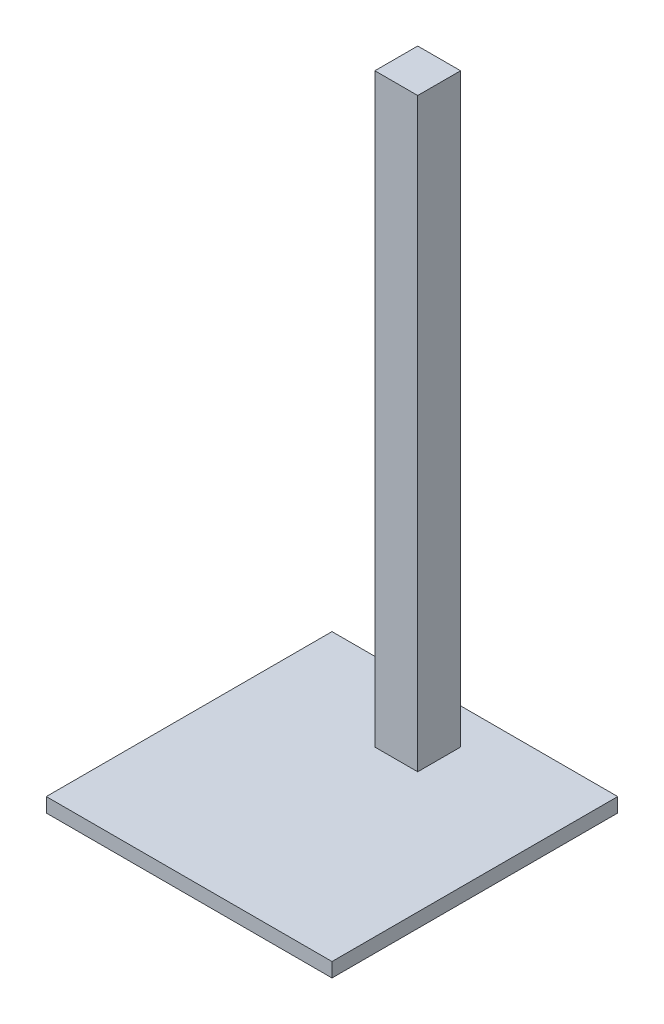
from build123d import *

# Parameters (mm, degrees)
SKETCH1_W           = 50.8
SKETCH1_H           = 50.8
BOSS_EXTRUDE1_DEPTH = 2.54
SKETCH2_W           = 7.62
SKETCH2_H           = 7.62
BOSS_EXTRUDE2_DEPTH = 104.14


with BuildPart() as part:
    # Sketch1 → Boss-Extrude1 (new body)
    with BuildSketch(Plane(origin=(0, 0, 0), x_dir=(1, 0, 0), z_dir=(0, 1, 0))):
        Rectangle(SKETCH1_W, SKETCH1_H)
    extrude(amount=BOSS_EXTRUDE1_DEPTH)

    # Sketch2 → Boss-Extrude2 (add)
    with BuildSketch(Plane(origin=(0, 2.54, 0), x_dir=(1, 0, 0), z_dir=(0, 1, 0))):
        with Locations((0, 15.24)):
            Rectangle(SKETCH2_W, SKETCH2_H)
    extrude(amount=BOSS_EXTRUDE2_DEPTH)


solid = part.part
